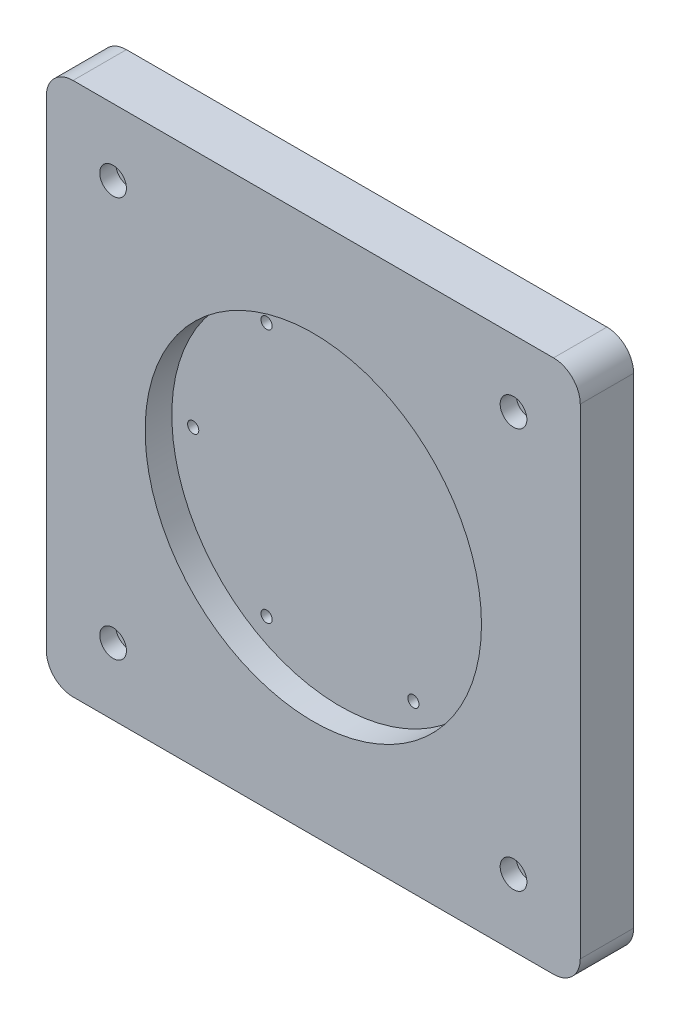
from build123d import *

# Parameters (mm, degrees)
SKETCH_1_W          = 200
SKETCH_1_H          = 200
SKETCH_1_R          = 63
EXTRUDE_1_DEPTH     = 10
SKETCH_2_W          = 200
SKETCH_2_H          = 200
EXTRUDE_2_DEPTH     = 10
SKETCH_3_R          = 2.1
CUT_EXTRUDE_1_DEPTH = 10
SKETCH_4_R          = 2.75
CUT_EXTRUDE_2_DEPTH = 143.828568571
SKETCH_5_R          = 5
CUT_EXTRUDE_3_DEPTH = 6
FILLET_1_R          = 10


with BuildPart() as part:
    # ｽｹｯﾁ1 → ﾎﾞｽ - 押し出し1 (new body)
    with BuildSketch(Plane.XY):
        Rectangle(SKETCH_1_W, SKETCH_1_H)
        Circle(SKETCH_1_R, mode=Mode.SUBTRACT)
    extrude(amount=EXTRUDE_1_DEPTH)

    # ｽｹｯﾁ2 → ﾎﾞｽ - 押し出し2 (add)
    with BuildSketch(Plane(origin=(0, 0, 0), x_dir=(-1, 0, 0), z_dir=(0, 0, -1))):
        Rectangle(SKETCH_2_W, SKETCH_2_H)
    extrude(amount=EXTRUDE_2_DEPTH)

    # ｽｹｯﾁ3 → ｶｯﾄ - 押し出し1 (cut)
    with BuildSketch(Plane.XY):
        with Locations((27.5, -47.631397208)):
            Circle(SKETCH_3_R)
        with Locations((-27.5, -47.631397208)):
            Circle(SKETCH_3_R)
        with Locations((-55, 0)):
            Circle(SKETCH_3_R)
        with Locations((-27.5, 47.631397208)):
            Circle(SKETCH_3_R)
        with Locations((27.5, 47.631397208)):
            Circle(SKETCH_3_R)
        with Locations((55, 0)):
            Circle(SKETCH_3_R)
    extrude(amount=-CUT_EXTRUDE_1_DEPTH, mode=Mode.SUBTRACT)

    # ｽｹｯﾁ4 → ｶｯﾄ - 押し出し2 (cut, through all)
    with BuildSketch(Plane.XY.offset(10)):
        with Locations((75, 75)):
            Circle(SKETCH_4_R)
        with Locations((75, -75)):
            Circle(SKETCH_4_R)
        with Locations((-75, -75)):
            Circle(SKETCH_4_R)
        with Locations((-75, 75)):
            Circle(SKETCH_4_R)
    extrude(amount=-CUT_EXTRUDE_2_DEPTH, mode=Mode.SUBTRACT)

    # ｽｹｯﾁ5 → ｶｯﾄ - 押し出し3 (cut)
    with BuildSketch(Plane.XY.offset(10)):
        with Locations((75, -75)):
            Circle(SKETCH_5_R)
        with Locations((-75, -75)):
            Circle(SKETCH_5_R)
        with Locations((-75, 75)):
            Circle(SKETCH_5_R)
        with Locations((75, 75)):
            Circle(SKETCH_5_R)
    extrude(amount=-CUT_EXTRUDE_3_DEPTH, mode=Mode.SUBTRACT)

    # ﾌｨﾚｯﾄ1
    fillet_1_edges = [part.edges().sort_by_distance(p)[0] for p in [
        (-100, -100, 0),
        (100, -100, 0),
        (100, 100, 0),
        (-100, 100, 0),
    ]]
    fillet(fillet_1_edges, radius=FILLET_1_R)


solid = part.part
